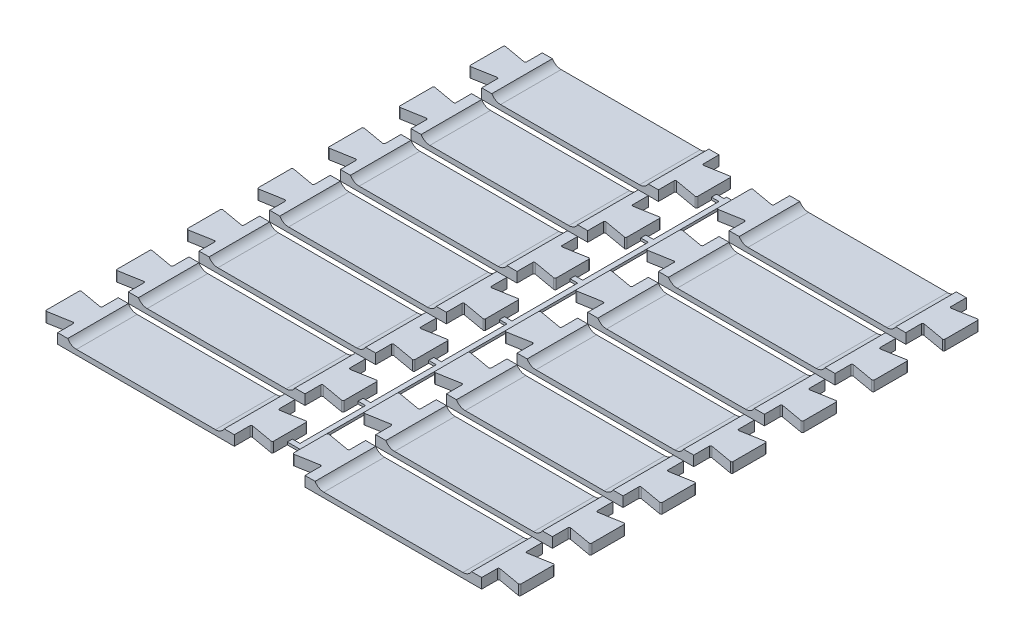
from build123d import *

# Parameters (mm, degrees)
BOSS_EXTRUDE1_DEPTH = 2
FILLET1_R           = 0.25
SKETCH3_W           = 31
SKETCH3_H           = 12
CUT_EXTRUDE2_DEPTH  = 1
FILLET6_R           = 2
SKETCH4_W           = 3
SKETCH4_H           = 1
BOSS_EXTRUDE2_DEPTH = 0.5
LPATTERN1_COUNT     = 7
LPATTERN1_PITCH     = 14
SKETCH5_W           = 1
SKETCH5_H           = 85
BOSS_EXTRUDE3_DEPTH = 0.5


with BuildPart() as part:
    # Sketch1 → Boss-Extrude1 (new body)
    with BuildSketch(Plane(origin=(0, 0, 0), x_dir=(1, 0, 0), z_dir=(0, 1, 0))):
        Polygon((-17.5, 2.618365096), (-22.5, 3.5), (-22.5, -3.5), (-17.5, -2.618365096), (-17.5, -6), (17.5, -6), (17.5, -2.618365096), (22.5, -3.5), (22.5, 3.5), (17.5, 2.618365096), (17.5, 6), (-17.5, 6), align=None)
    extrude(amount=BOSS_EXTRUDE1_DEPTH)

    # Fillet1
    fillet1_edges = [part.edges().sort_by_distance(p)[0] for p in [
        (17.5, 1, -2.618365096),
        (22.5, 1, -3.5),
        (22.5, 1, 3.5),
        (17.5, 1, 2.618365096),
        (-17.5, 1, 2.618365096),
        (-22.5, 1, 3.5),
        (-22.5, 1, -3.5),
        (-17.5, 1, -2.618365096),
    ]]
    fillet(fillet1_edges, radius=FILLET1_R)

    # Sketch3 → Cut-Extrude2 (cut)
    with BuildSketch(Plane(origin=(0, 2, 0), x_dir=(1, 0, 0), z_dir=(0, 1, 0))):
        Rectangle(SKETCH3_W, SKETCH3_H)
    extrude(amount=-CUT_EXTRUDE2_DEPTH, mode=Mode.SUBTRACT)

    # Fillet6
    # the kernel refuses this fillet: 2 mm, written as the material it adds along each edge
    with BuildSketch(Plane(origin=(-15.5, 1, 6), x_dir=(0, 1, 0), z_dir=(0, 0, -1))) as fillet6_piece_1:
        with BuildLine():
            CenterArc((2, 1.732050808), FILLET6_R, 180, 60)
            Line((0, 1.732050808), (-0.04, 1.732050808))
            Line((-0.04, 1.732050808), (-0.04, 0))
            Line((-0.04, 0), (0, -0.04))
            ThreePointArc((0, -0.04), (0.5, -0.04), (0.98, -0.034641016))
            Line((0.98, -0.034641016), (1, 0))
        make_face()
    extrude(amount=12)
    with BuildSketch(Plane(origin=(15.5, 1, -6), x_dir=(-1, 0, 0), z_dir=(0, 0, 1))) as fillet6_piece_2:
        with BuildLine():
            CenterArc((1.732050808, -2), FILLET6_R, 90, 60)
            Line((0, -1), (-0.034641016, -0.98))
            ThreePointArc((-0.034641016, -0.98), (-0.04, -0.5), (-0.04, 0))
            Line((-0.04, 0), (0, 0.04))
            Line((0, 0.04), (1.732050808, 0.04))
            Line((1.732050808, 0.04), (1.732050808, 0))
        make_face()
    extrude(amount=12)

    # Sketch4 → Boss-Extrude2 (add)
    with BuildSketch(Plane(origin=(0, 0, 0), x_dir=(1, 0, 0), z_dir=(0, 1, 0))):
        with Locations((23, 0)):
            Rectangle(SKETCH4_W, SKETCH4_H)
    extrude(amount=BOSS_EXTRUDE2_DEPTH)

    # Mirror1: part across plane


with BuildPart() as part_1:
    add(part.part)
    add(part.part.mirror(Plane(origin=(24.5, 0, 0), x_dir=(0, 0, 1), z_dir=(1, 0, 0))))


with BuildPart() as lpattern1_1:
    # LPattern1: pattern copy
    add(part_1.part.moved(Location(Vector(0, 0, -1) * (1 * LPATTERN1_PITCH))))


with BuildPart() as lpattern1_2:
    # LPattern1: pattern copy
    add(part_1.part.moved(Location(Vector(0, 0, -1) * (2 * LPATTERN1_PITCH))))


with BuildPart() as lpattern1_3:
    # LPattern1: pattern copy
    add(part_1.part.moved(Location(Vector(0, 0, -1) * (3 * LPATTERN1_PITCH))))


with BuildPart() as lpattern1_4:
    # LPattern1: pattern copy
    add(part_1.part.moved(Location(Vector(0, 0, -1) * (4 * LPATTERN1_PITCH))))


with BuildPart() as lpattern1_5:
    # LPattern1: pattern copy
    add(part_1.part.moved(Location(Vector(0, 0, -1) * (5 * LPATTERN1_PITCH))))


with BuildPart() as lpattern1_6:
    # LPattern1: pattern copy
    add(part_1.part.moved(Location(Vector(0, 0, -1) * (6 * LPATTERN1_PITCH))))


with BuildPart() as part_2:
    add(part_1.part)

    # Sketch5 → Boss-Extrude3 (add)
    with BuildSketch(Plane(origin=(0, 0, 0), x_dir=(1, 0, 0), z_dir=(0, 1, 0))):
        with Locations((24.5, 42.5)):
            Rectangle(SKETCH5_W, SKETCH5_H)
    extrude(amount=BOSS_EXTRUDE3_DEPTH)

    # Combine1: union LPattern1_1, LPattern1_2, LPattern1_3, LPattern1_4, LPattern1_5, LPattern1_6
    add(lpattern1_1.part)
    add(lpattern1_2.part)
    add(lpattern1_3.part)
    add(lpattern1_4.part)
    add(lpattern1_5.part)
    add(lpattern1_6.part)


solid = part_2.part
